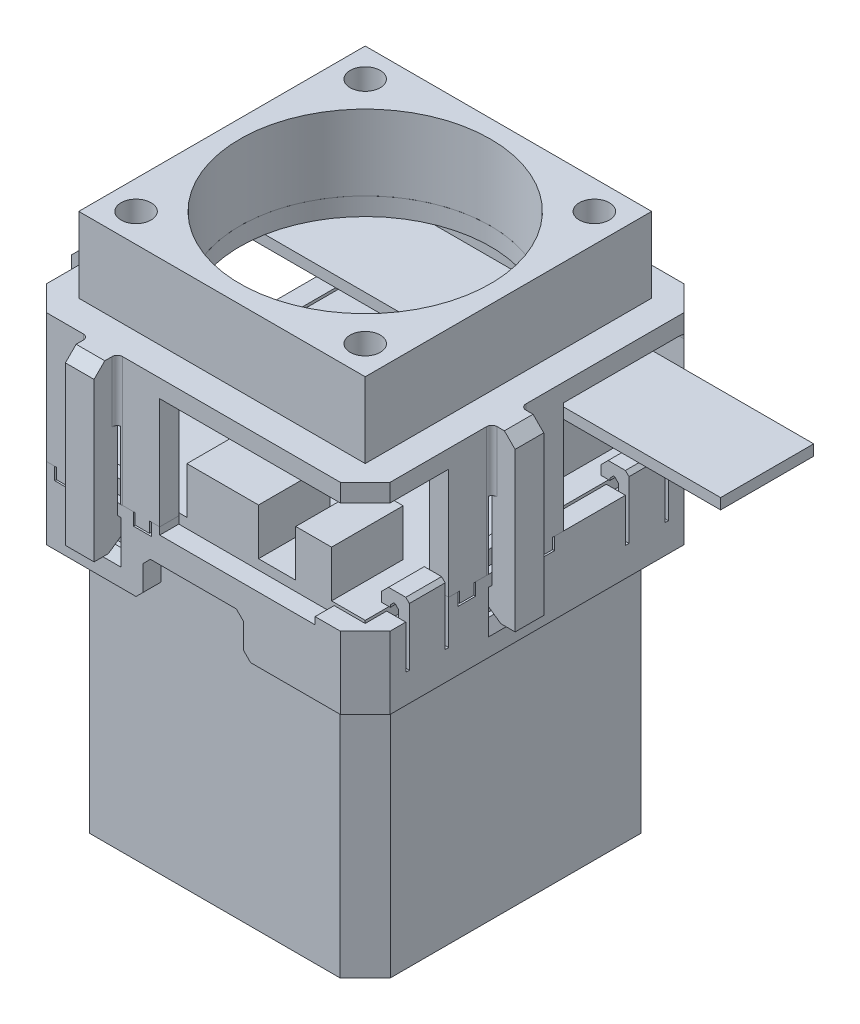
from build123d import *
from OCP.BRepFilletAPI import BRepFilletAPI_MakeChamfer

# Parameters (mm, degrees)
SKETCH1_W              = 41.91
SKETCH1_H              = 41.91
BOSS_EXTRUDE1_DEPTH    = 1.5748
SKETCH3_W              = 42
SKETCH3_H              = 42
BOSS_EXTRUDE2_DEPTH    = 40.386
CHAMFER1_SIZE          = 3.5
SKETCH4_W              = 6.2
SKETCH4_H              = 16.5
BOSS_EXTRUDE3_DEPTH    = 13
SKETCH5_W              = 74.640338871
SKETCH5_H              = 13
BOSS_EXTRUDE4_DEPTH    = 1.5
SKETCH6_W              = 10
SKETCH6_H              = 10
SKETCH6_W_2            = 5
BOSS_EXTRUDE5_DEPTH    = 6.5
BOSS_EXTRUDE6_DEPTH    = 5.5
BOSS_EXTRUDE7_DEPTH    = 3
SKETCH12_W             = 42.672
SKETCH12_H             = 42.672
BOSS_EXTRUDE8_DEPTH    = 1.5748
SKETCH13_W             = 2.336
SKETCH13_H             = 7
SKETCH13_W_2           = 6
SKETCH13_H_2           = 2.164427125
SKETCH13_W_3           = 8
SKETCH13_H_3           = 1.5
CUT_EXTRUDE2_DEPTH     = 3
SKETCH14_W             = 2
SKETCH14_H             = 6
CUT_EXTRUDE3_DEPTH     = 6.0748
SKETCH15_W             = 1.5
SKETCH15_H             = 5
BOSS_EXTRUDE9_DEPTH    = 7.0748
SKETCH16_W             = 3.914
SKETCH16_H             = 5
BOSS_EXTRUDE10_DEPTH   = 1.5
SKETCH9_W              = 14
SKETCH9_H              = 2.5
CUT_EXTRUDE1_DEPTH     = 5.5
SKETCH18_W             = 0.664
SKETCH18_H             = 6
CUT_EXTRUDE4_DEPTH     = 1.5748
SKETCH17_W             = 1.25
SKETCH17_H             = 5
BOSS_EXTRUDE11_DEPTH   = 0.7968
CHAMFER2_SIZE          = 0.5
CHAMFER3_SIZE          = 1
CHAMFER4_SIZE          = 1
CHAMFER5_SIZE          = 1
CHAMFER6_SIZE          = 0.5
SKETCH19_W             = 21.7
SKETCH19_H             = 1
CUT_EXTRUDE5_DEPTH     = 2.664
SKETCH20_W             = 40
SKETCH20_H             = 40
SKETCH20_R             = 17.5
SKETCH20_R_2           = 2.1
BOSS_EXTRUDE12_DEPTH   = 10.5
SKETCH21_W             = 2.664
SKETCH21_H             = 16.041
BOSS_EXTRUDE13_DEPTH   = 18
BOSS_EXTRUDE13_2_DEPTH = 18
BOSS_EXTRUDE13_3_DEPTH = 18
SKETCH22_R             = 17.5
SKETCH22_R_2           = 1.25
BOSS_EXTRUDE14_DEPTH   = 2.5
FILLET1_R              = 1.5
SKETCH23_R             = 3.25
SKETCH23_R_2           = 1.25
BOSS_EXTRUDE15_DEPTH   = 1
SKETCH25_W             = 5
SKETCH25_H             = 1
SKETCH25_W_2           = 1
SKETCH25_H_2           = 5
CUT_EXTRUDE6_DEPTH     = 9.5
SKETCH26_W             = 5
SKETCH26_H             = 1.5
SKETCH26_W_2           = 1.5
SKETCH26_H_2           = 5
CUT_EXTRUDE7_DEPTH     = 4.5
CHAMFER7_SIZE          = 1.5
CHAMFER7_SIZE2         = 0.866025404
BOSS_EXTRUDE16_REACH   = 102.968
SKETCH28_W             = 4
SKETCH28_H             = 3.25
SKETCH28_W_2           = 3.25
SKETCH28_H_2           = 4
SKETCH29_W             = 4
SKETCH29_H             = 5.25
SKETCH29_W_2           = 5.25
SKETCH29_H_2           = 4
BOSS_EXTRUDE17_DEPTH   = 4
FILLET3_START          = 11.0748
FILLET3_DEPTH          = 8.5
FILLET3_START_2        = 1.5748
FILLET3_2_DEPTH        = 9.5
CHAMFER10_SIZE         = 1.5
CHAMFER11_SIZE         = 3.25
CHAMFER11_SIZE2        = 2.275674499
SKETCH31_W             = 2
SKETCH31_H             = 2.164
SKETCH31_W_2           = 2.164
SKETCH31_H_2           = 2
BOSS_EXTRUDE18_DEPTH   = 1.5
SKETCH32_W             = 2.5
SKETCH32_H             = 2.664
SKETCH32_W_2           = 2.664
SKETCH32_H_2           = 2.5
CUT_EXTRUDE9_DEPTH     = 1.75
SKETCH33_W             = 5
SKETCH33_H             = 7.5
CUT_EXTRUDE10_DEPTH    = 1.664
SKETCH34_W             = 5
SKETCH34_H             = 7.5
CUT_EXTRUDE11_DEPTH    = 1.664
SKETCH35_W             = 5
SKETCH35_H             = 7.5
CUT_EXTRUDE12_DEPTH    = 1.664
SKETCH36_W             = 5
SKETCH36_H             = 7.5
CUT_EXTRUDE13_DEPTH    = 1.664


with BuildPart() as part:
    # Sketch1 → Boss-Extrude1 (new body)
    with BuildSketch(Plane(origin=(0, 0, 0), x_dir=(1, 0, 0), z_dir=(0, 1, 0))):
        with Locations((20.955, 20.955)):
            Rectangle(SKETCH1_W, SKETCH1_H)
    extrude(amount=BOSS_EXTRUDE1_DEPTH)

    # Sketch4 → Boss-Extrude3 (add)
    with BuildSketch(Plane(origin=(0, 1.5748, 0), x_dir=(1, 0, 0), z_dir=(0, 1, 0))):
        with Locations((35.31, 33.16)):
            Rectangle(SKETCH4_W, SKETCH4_H)
    extrude(amount=BOSS_EXTRUDE3_DEPTH)

    # Sketch5 → Boss-Extrude4 (add)
    with BuildSketch(Plane(origin=(0, 14.5748, 0), x_dir=(1, 0, 0), z_dir=(0, 1, 0))):
        with Locations((27.561027235, 33.16)):
            Rectangle(SKETCH5_W, SKETCH5_H)
    extrude(amount=-BOSS_EXTRUDE4_DEPTH)

    # Sketch6 → Boss-Extrude5 (add)
    with BuildSketch(Plane(origin=(0, 1.5748, 0), x_dir=(1, 0, 0), z_dir=(0, 1, 0))):
        with Locations((22.01, 5)):
            Rectangle(SKETCH6_W, SKETCH6_H)
        with Locations((34.71, 5)):
            Rectangle(SKETCH6_W_2, SKETCH6_H)
    extrude(amount=BOSS_EXTRUDE5_DEPTH)


with BuildPart() as body_2:
    # Sketch3 → Boss-Extrude2 (new body)
    with BuildSketch(Plane(origin=(0, -3, 0), x_dir=(-1, 0, 0), z_dir=(0, -1, 0))):
        with Locations((-20.955, 20.955)):
            Rectangle(SKETCH3_W, SKETCH3_H)
    extrude(amount=BOSS_EXTRUDE2_DEPTH)

    # Chamfer1
    chamfer1_edges = [body_2.edges().sort_by_distance(p)[0] for p in [
        (41.955, -23.193, -41.955),
        (-0.045, -23.193, -41.955),
        (-0.045, -23.193, 0.045),
        (41.955, -23.193, 0.045),
    ]]
    chamfer(chamfer1_edges, length=CHAMFER1_SIZE)


with BuildPart() as body_3:
    # Sketch7 → Boss-Extrude6 (new body)
    with BuildSketch(Plane(origin=(0, -3, 0), x_dir=(1, 0, 0), z_dir=(0, 1, 0))):
        Polygon((41.490533906, 44.955), (0.419466094, 44.955), (-3.045, 41.490533906), (-3.045, 0.419466094), (0.419466094, -3.045), (41.490533906, -3.045), (44.955, 0.419466094), (44.955, 41.490533906), align=None)
        Polygon((1.455, 42.455), (-0.545, 40.455), (-0.545, 1.455), (1.455, -0.545), (40.455, -0.545), (42.455, 1.455), (42.455, 40.455), (40.455, 42.455), align=None, mode=Mode.SUBTRACT)
    extrude(amount=-BOSS_EXTRUDE6_DEPTH)

    # Sketch11 → Boss-Extrude7 (add)
    with BuildSketch(Plane(origin=(0, -3, 0), x_dir=(1, 0, 0), z_dir=(0, 1, 0))):
        Polygon((44.955, 41.490533906), (41.490533906, 44.955), (0.419466094, 44.955), (-3.045, 41.490533906), (-3.045, 0.419466094), (0.419466094, -3.045), (41.490533906, -3.045), (44.955, 0.419466094), align=None)
        Polygon((1.955, 37.626572875), (1.955, 4.283427125), (4.283427125, 1.955), (37.626572875, 1.955), (39.955, 4.283427125), (39.955, 37.626572875), (37.626572875, 39.955), (4.283427125, 39.955), align=None, mode=Mode.SUBTRACT)
    extrude(amount=BOSS_EXTRUDE7_DEPTH)

    # Sketch12 → Boss-Extrude8 (add)
    with BuildSketch(Plane(origin=(0, 0, 0), x_dir=(1, 0, 0), z_dir=(0, 1, 0))):
        Polygon((44.955, 0.419466094), (44.955, 41.490533906), (41.490533906, 44.955), (0.419466094, 44.955), (-3.045, 41.490533906), (-3.045, 0.419466094), (0.419466094, -3.045), (41.490533906, -3.045), align=None)
        with Locations((20.955, 20.955)):
            Rectangle(SKETCH12_W, SKETCH12_H, mode=Mode.SUBTRACT)
    extrude(amount=BOSS_EXTRUDE8_DEPTH)

    # Sketch13 → Cut-Extrude2 (cut)
    with BuildSketch(Plane(origin=(0, 0, 0), x_dir=(1, 0, 0), z_dir=(0, 1, 0))):
        with Locations((0.787, 33.291)):
            Rectangle(SKETCH13_W, SKETCH13_H)
        with Locations((35.291, 1.537213563)):
            Rectangle(SKETCH13_W_2, SKETCH13_H_2)
        with Locations((11.119, 40.705)):
            Rectangle(SKETCH13_W_3, SKETCH13_H_3)
    extrude(amount=-CUT_EXTRUDE2_DEPTH, mode=Mode.SUBTRACT)

    # Sketch14 → Cut-Extrude3 (cut)
    with BuildSketch(Plane(origin=(0, 1.5748, 0), x_dir=(1, 0, 0), z_dir=(0, 1, 0))):
        with Locations((-2.045, 20.955)):
            Rectangle(SKETCH14_W, SKETCH14_H)
        with Locations((43.955, 36.291)):
            Rectangle(SKETCH14_W, SKETCH14_H)
        with Locations((43.955, 5.619)):
            Rectangle(SKETCH14_W, SKETCH14_H)
    extrude(amount=-CUT_EXTRUDE3_DEPTH, mode=Mode.SUBTRACT)

    # Sketch15 → Boss-Extrude9 (add)
    with BuildSketch(Plane(origin=(0, -4.5, 0), x_dir=(1, 0, 0), z_dir=(0, 1, 0))):
        with Locations((-2.295, 20.955)):
            Rectangle(SKETCH15_W, SKETCH15_H)
        with Locations((44.205, 36.291)):
            Rectangle(SKETCH15_W, SKETCH15_H)
        with Locations((44.205, 5.619)):
            Rectangle(SKETCH15_W, SKETCH15_H)
    extrude(amount=BOSS_EXTRUDE9_DEPTH)

    # Sketch16 → Boss-Extrude10 (add)
    with BuildSketch(Plane(origin=(0, 2.5748, 0), x_dir=(1, 0, 0), z_dir=(0, 1, 0))):
        with Locations((-1.088, 20.955)):
            Rectangle(SKETCH16_W, SKETCH16_H)
        with Locations((42.998, 36.291)):
            Rectangle(SKETCH16_W, SKETCH16_H)
        with Locations((42.998, 5.619)):
            Rectangle(SKETCH16_W, SKETCH16_H)
    extrude(amount=BOSS_EXTRUDE10_DEPTH)

    # Sketch9 → Cut-Extrude1 (cut)
    with BuildSketch(Plane(origin=(0, -8.5, 0), x_dir=(1, 0, 0), z_dir=(0, 1, 0))):
        with Locations((20.955, -1.795)):
            Rectangle(SKETCH9_W, SKETCH9_H)
    extrude(amount=CUT_EXTRUDE1_DEPTH, mode=Mode.SUBTRACT)

    # Sketch18 → Cut-Extrude4 (cut)
    with BuildSketch(Plane(origin=(0, 1.5748, 0), x_dir=(1, 0, 0), z_dir=(0, 1, 0))):
        with Locations((-0.713, 20.955)):
            Rectangle(SKETCH18_W, SKETCH18_H)
        with Locations((42.623, 36.291)):
            Rectangle(SKETCH18_W, SKETCH18_H)
        with Locations((42.623, 5.619)):
            Rectangle(SKETCH18_W, SKETCH18_H)
    extrude(amount=-CUT_EXTRUDE4_DEPTH, mode=Mode.SUBTRACT)

    # Sketch17 → Boss-Extrude11 (add)
    with BuildSketch(Plane.XZ.offset(-2.5748)):
        with Locations((0.244, -20.955)):
            Rectangle(SKETCH17_W, SKETCH17_H)
        with Locations((41.666, -5.619)):
            Rectangle(SKETCH17_W, SKETCH17_H)
        with Locations((41.666, -36.291)):
            Rectangle(SKETCH17_W, SKETCH17_H)
    extrude(amount=BOSS_EXTRUDE11_DEPTH)

    # Chamfer2
    chamfer2_edges = [body_3.edges().sort_by_distance(p)[0] for p in [
        (-0.381, 2.5748, -20.955),
        (-1.545, 2.5748, -20.955),
        (42.291, 2.5748, -5.619),
        (43.455, 2.5748, -5.619),
        (43.455, 2.5748, -36.291),
        (42.291, 2.5748, -36.291),
    ]]
    chamfer(chamfer2_edges, length=CHAMFER2_SIZE)

    # Chamfer3
    chamfer3_edges = [body_3.edges().sort_by_distance(p)[0] for p in [
        (0.869, 4.0748, -20.955),
        (41.041, 4.0748, -36.291),
        (41.041, 4.0748, -5.619),
    ]]
    chamfer(chamfer3_edges, length=CHAMFER3_SIZE)

    # Chamfer4
    chamfer4_edges = [body_3.edges().sort_by_distance(p)[0] for p in [
        (20.955, -8.5, -42.455),
        (41.455, -8.5, -41.455),
        (42.455, -8.5, -20.955),
        (41.455, -8.5, -0.455),
        (7.705, -8.5, 0.545),
        (0.455, -8.5, -0.455),
        (-0.545, -8.5, -20.955),
        (34.205, -8.5, 0.545),
        (0.455, -8.5, -41.455),
    ]]
    chamfer(chamfer4_edges, length=CHAMFER4_SIZE)

    # Chamfer5
    chamfer5_edges = [body_3.edges().sort_by_distance(p)[0] for p in [
        (13.955, -8.5, 2.295),
        (27.955, -8.5, 2.295),
        (27.955, -3, 1.795),
        (13.955, -3, 1.795),
    ]]
    chamfer(chamfer5_edges, length=CHAMFER5_SIZE)

    # Chamfer6
    chamfer6_edges = [body_3.edges().sort_by_distance(p)[0] for p in [
        (-3.045, 4.0748, -20.955),
        (44.955, 4.0748, -36.291),
        (44.955, 4.0748, -5.619),
    ]]
    chamfer(chamfer6_edges, length=CHAMFER6_SIZE)

    # Sketch19 → Cut-Extrude5 (cut)
    with BuildSketch(Plane.XY.offset(3.045)):
        with Locations((27.11, 1.0748)):
            Rectangle(SKETCH19_W, SKETCH19_H)
    extrude(amount=-CUT_EXTRUDE5_DEPTH, mode=Mode.SUBTRACT)

    # Sketch26 → Cut-Extrude7 (cut)
    with BuildSketch(Plane.XZ):
        with Locations((8.339733047, 2.295)):
            Rectangle(SKETCH26_W, SKETCH26_H)
        with Locations((-2.295, -9.187233047)):
            Rectangle(SKETCH26_W_2, SKETCH26_H_2)
        with Locations((20.955, -44.205)):
            Rectangle(SKETCH26_W, SKETCH26_H)
        with Locations((44.205, -16.6395)):
            Rectangle(SKETCH26_W_2, SKETCH26_H_2)
    extrude(amount=CUT_EXTRUDE7_DEPTH, mode=Mode.SUBTRACT)

    # Chamfer7: one chamfer whose edges measure the first distance from different faces: ONE call of the kernel's chamfer builder (chamfer() names one face for all edges)
    chamfer7_edges_1 = [body_3.edges().sort_by_distance(p)[0] for p in [
        (8.339733047, -4.5, 3.045),
    ]]
    chamfer7_side_1 = [body_3.faces().sort_by_distance(p)[0] for p in [
        (28.75402627, -7.70097373, 3.045),
    ]]
    chamfer7_edges_2 = [body_3.edges().sort_by_distance(p)[0] for p in [
        (44.955, -4.5, -16.6395),
    ]]
    chamfer7_side_2 = [body_3.faces().sort_by_distance(p)[0] for p in [
        (44.955, -3.289311231, -21.198274054),
    ]]
    chamfer7_edges_3 = [body_3.edges().sort_by_distance(p)[0] for p in [
        (20.955, -4.5, -44.955),
    ]]
    chamfer7_side_3 = [body_3.faces().sort_by_distance(p)[0] for p in [
        (20.955, -8.077112993, -44.955),
    ]]
    chamfer7_edges_4 = [body_3.edges().sort_by_distance(p)[0] for p in [
        (-3.045, -4.5, -9.187233047),
    ]]
    chamfer7_side_4 = [body_3.faces().sort_by_distance(p)[0] for p in [
        (-3.045, -3.409612965, -21.624963059),
    ]]
    chamfer7 = BRepFilletAPI_MakeChamfer(body_3.part.solid().wrapped)
    for e in chamfer7_edges_1:
        chamfer7.Add(CHAMFER7_SIZE, CHAMFER7_SIZE2, e.wrapped, chamfer7_side_1[0].wrapped)  # the first distance lies on this face
    for e in chamfer7_edges_2:
        chamfer7.Add(CHAMFER7_SIZE, CHAMFER7_SIZE2, e.wrapped, chamfer7_side_2[0].wrapped)  # the first distance lies on this face
    for e in chamfer7_edges_3:
        chamfer7.Add(CHAMFER7_SIZE, CHAMFER7_SIZE2, e.wrapped, chamfer7_side_3[0].wrapped)  # the first distance lies on this face
    for e in chamfer7_edges_4:
        chamfer7.Add(CHAMFER7_SIZE, CHAMFER7_SIZE2, e.wrapped, chamfer7_side_4[0].wrapped)  # the first distance lies on this face
    add(Compound.cast(chamfer7.Shape()), mode=Mode.REPLACE)


with BuildPart() as body_4:
    # Sketch20 → Boss-Extrude12 (new body)
    with BuildSketch(Plane(origin=(0, 19.5748, 0), x_dir=(1, 0, 0), z_dir=(0, 1, 0))):
        with Locations((20.955, 20.955)):
            Rectangle(SKETCH20_W, SKETCH20_H)
        with Locations(Location((20.955, 20.955, 0), (0, 0, 90))):
            Circle(SKETCH20_R, mode=Mode.SUBTRACT)
        with Locations(Location((4.955, 36.955, 0), (0, 0, 90))):
            Circle(SKETCH20_R_2, mode=Mode.SUBTRACT)
        with Locations(Location((36.955, 36.955, 0), (0, 0, 90))):
            Circle(SKETCH20_R_2, mode=Mode.SUBTRACT)
        with Locations(Location((4.955, 4.955, 0), (0, 0, 90))):
            Circle(SKETCH20_R_2, mode=Mode.SUBTRACT)
        with Locations(Location((36.955, 4.955, 0), (0, 0, 90))):
            Circle(SKETCH20_R_2, mode=Mode.SUBTRACT)
    extrude(amount=BOSS_EXTRUDE12_DEPTH)


with BuildPart() as body_5:
    # Sketch21 → Boss-Extrude13 (new body)
    with BuildSketch(Plane.XZ.offset(-19.5748)):
        with Locations((43.623, -16.6395)):
            Rectangle(SKETCH21_W, SKETCH21_H)
    extrude(amount=BOSS_EXTRUDE13_DEPTH)


with BuildPart() as body_6:
    # Sketch21 → Boss-Extrude13 2 (new body)
    with BuildSketch(Plane.XZ.offset(-19.5748)):
        Polygon((16.26, 0.381), (16.26, 3.045), (0.419466094, 3.045), (-3.045, -0.419466094), (-3.045, -17.955), (-0.381, -17.955), (-0.381, 0.381), align=None)
    extrude(amount=BOSS_EXTRUDE13_2_DEPTH)


    add(body_5.part)  # Boss-Extrude14 merges body 5


with BuildPart() as body_7:
    # Sketch21 → Boss-Extrude13 3 (new body)
    with BuildSketch(Plane.XZ.offset(-19.5748)):
        Polygon((41.490533906, -44.955), (44.154533906, -42.291), (-2.244533906, -42.291), (0.419466094, -44.955), align=None)
    extrude(amount=BOSS_EXTRUDE13_3_DEPTH)


with BuildPart() as body_6_1:
    add(body_6.part)

    add(body_7.part)  # Boss-Extrude14 merges body 7
    # Sketch22 → Boss-Extrude14 (add)
    with BuildSketch(Plane(origin=(0, 19.5748, 0), x_dir=(1, 0, 0), z_dir=(0, 1, 0))):
        Polygon((0.419466094, 44.955), (41.490533906, 44.955), (44.955, 41.490533906), (44.955, 0.419466094), (41.490533906, -3.045), (0.419466094, -3.045), (-3.045, 0.419466094), (-3.045, 41.490533906), align=None)
        with Locations(Location((20.955, 20.955, 0), (0, 0, 270))):
            Circle(SKETCH22_R, mode=Mode.SUBTRACT)
        with Locations(Location((4.955, 36.955, 0), (0, 0, 270))):
            Circle(SKETCH22_R_2, mode=Mode.SUBTRACT)
        with Locations(Location((36.955, 36.955, 0), (0, 0, 270))):
            Circle(SKETCH22_R_2, mode=Mode.SUBTRACT)
        with Locations(Location((36.955, 4.955, 0), (0, 0, 270))):
            Circle(SKETCH22_R_2, mode=Mode.SUBTRACT)
        with Locations(Location((4.955, 4.955, 0), (0, 0, 270))):
            Circle(SKETCH22_R_2, mode=Mode.SUBTRACT)
    extrude(amount=-BOSS_EXTRUDE14_DEPTH)

    # Fillet1
    fillet1_edges = [body_6_1.edges().sort_by_distance(p)[0] for p in [
        (42.291, 17.0748, -16.6395),
        (7.9395, 17.0748, 0.381),
        (-0.381, 17.0748, -8.787),
        (20.955, 17.0748, -42.291),
    ]]
    fillet(fillet1_edges, radius=FILLET1_R)

    # Sketch23 → Boss-Extrude15 (add)
    # profile 1 of 4: a face of its own
    with BuildSketch(Plane.XZ.offset(-17.0748)):
        with Locations(Location((4.955, -36.955, 0), (0, 0, 270))):
            Circle(SKETCH23_R)
        with Locations(Location((4.955, -36.955, 0), (0, 0, 90))):
            Circle(SKETCH23_R_2, mode=Mode.SUBTRACT)
    # profile 2 of 4: a face of its own
    with BuildSketch(Plane.XZ.offset(-17.0748)):
        with Locations(Location((36.955, -36.955, 0), (0, 0, 270))):
            Circle(SKETCH23_R)
        with Locations(Location((36.955, -36.955, 0), (0, 0, 90))):
            Circle(SKETCH23_R_2, mode=Mode.SUBTRACT)
    # profile 3 of 4: a face of its own
    with BuildSketch(Plane.XZ.offset(-17.0748)):
        with Locations(Location((4.955, -4.955, 0), (0, 0, 270))):
            Circle(SKETCH23_R)
        with Locations(Location((4.955, -4.955, 0), (0, 0, 90))):
            Circle(SKETCH23_R_2, mode=Mode.SUBTRACT)
    # profile 4 of 4: a face of its own
    with BuildSketch(Plane.XZ.offset(-17.0748)):
        with Locations(Location((36.955, -4.955, 0), (0, 0, 270))):
            Circle(SKETCH23_R)
        with Locations(Location((36.955, -4.955, 0), (0, 0, 90))):
            Circle(SKETCH23_R_2, mode=Mode.SUBTRACT)
    extrude(amount=BOSS_EXTRUDE15_DEPTH)

    # Sketch25 → Cut-Extrude6 (cut)
    with BuildSketch(Plane.XZ.offset(-1.5748)):
        with Locations((8.339733047, 2.545)):
            Rectangle(SKETCH25_W, SKETCH25_H)
        with Locations((-2.545, -9.187233047)):
            Rectangle(SKETCH25_W_2, SKETCH25_H_2)
        with Locations((20.955, -44.455)):
            Rectangle(SKETCH25_W, SKETCH25_H)
        with Locations((44.455, -16.6395)):
            Rectangle(SKETCH25_W_2, SKETCH25_H_2)
    extrude(amount=-CUT_EXTRUDE6_DEPTH, mode=Mode.SUBTRACT)


    # Boss-Extrude16: up to this face of the body (flat: up to its plane)
    boss_extrude16_end = Plane(body_3.part.faces().sort_by_distance((20.955, 0, -44.205))[0])
    # Sketch28 → Boss-Extrude16 (add, up to the picked face)
    with BuildSketch(Plane(origin=(0, 19.5748, 0), x_dir=(1, 0, 0), z_dir=(0, 1, 0)), mode=Mode.PRIVATE) as boss_extrude16_sk1:
        with Locations((8.339733047, -4.67)):
            Rectangle(SKETCH28_W, SKETCH28_H)
    boss_extrude16_tool1 = split(extrude(boss_extrude16_sk1.sketch, amount=-BOSS_EXTRUDE16_REACH, mode=Mode.PRIVATE), bisect_by=boss_extrude16_end, keep=Keep.BOTH, mode=Mode.PRIVATE)
    # Sketch28 → Boss-Extrude16 (add, up to the picked face)
    with BuildSketch(Plane(origin=(0, 19.5748, 0), x_dir=(1, 0, 0), z_dir=(0, 1, 0)), mode=Mode.PRIVATE) as boss_extrude16_sk2:
        with Locations((-4.67, 9.187233047)):
            Rectangle(SKETCH28_W_2, SKETCH28_H_2)
    boss_extrude16_tool2 = split(extrude(boss_extrude16_sk2.sketch, amount=-BOSS_EXTRUDE16_REACH, mode=Mode.PRIVATE), bisect_by=boss_extrude16_end, keep=Keep.BOTH, mode=Mode.PRIVATE)
    # Sketch28 → Boss-Extrude16 (add, up to the picked face)
    with BuildSketch(Plane(origin=(0, 19.5748, 0), x_dir=(1, 0, 0), z_dir=(0, 1, 0)), mode=Mode.PRIVATE) as boss_extrude16_sk3:
        with Locations((20.955, 46.58)):
            Rectangle(SKETCH28_W, SKETCH28_H)
    boss_extrude16_tool3 = split(extrude(boss_extrude16_sk3.sketch, amount=-BOSS_EXTRUDE16_REACH, mode=Mode.PRIVATE), bisect_by=boss_extrude16_end, keep=Keep.BOTH, mode=Mode.PRIVATE)
    # Sketch28 → Boss-Extrude16 (add, up to the picked face)
    with BuildSketch(Plane(origin=(0, 19.5748, 0), x_dir=(1, 0, 0), z_dir=(0, 1, 0)), mode=Mode.PRIVATE) as boss_extrude16_sk4:
        with Locations((46.58, 16.6395)):
            Rectangle(SKETCH28_W_2, SKETCH28_H_2)
    boss_extrude16_tool4 = split(extrude(boss_extrude16_sk4.sketch, amount=-BOSS_EXTRUDE16_REACH, mode=Mode.PRIVATE), bisect_by=boss_extrude16_end, keep=Keep.BOTH, mode=Mode.PRIVATE)
    add(boss_extrude16_tool1.solids().sort_by(Axis((8.339733, 19.5748, 4.67), (0, -1, 0)))[0])
    add(boss_extrude16_tool2.solids().sort_by(Axis((-4.67, 19.5748, -9.187233), (0, -1, 0)))[0])
    add(boss_extrude16_tool3.solids().sort_by(Axis((20.955, 19.5748, -46.58), (0, -1, 0)))[0])
    add(boss_extrude16_tool4.solids().sort_by(Axis((46.58, 19.5748, -16.6395), (0, -1, 0)))[0])

    # Sketch29 → Boss-Extrude17 (add)
    with BuildSketch(Plane.XZ):
        with Locations((8.339733047, 3.67)):
            Rectangle(SKETCH29_W, SKETCH29_H)
        with Locations((-3.67, -9.187233047)):
            Rectangle(SKETCH29_W_2, SKETCH29_H_2)
        with Locations((20.955, -45.58)):
            Rectangle(SKETCH29_W, SKETCH29_H)
        with Locations((45.58, -16.6395)):
            Rectangle(SKETCH29_W_2, SKETCH29_H_2)
    extrude(amount=BOSS_EXTRUDE17_DEPTH)

    # Fillet3: read off the stored shape, not the designer's step
    # Fillet3 outline → Fillet3 (add)
    with BuildSketch(Plane(origin=(0, 0, 0), x_dir=(1, 0, 0), z_dir=(0, 1, 0)).offset(FILLET3_START)):
        with BuildLine():
            Line((44.955, 18.6395), (45.705, 18.6395))
            ThreePointArc((45.705, 18.6395), (45.174669914, 18.859169914), (44.955, 19.3895))
            Line((44.955, 19.3895), (44.955, 18.6395))
        make_face()
        with BuildLine():
            ThreePointArc((44.955, 13.8895), (45.174669914, 14.419830086), (45.705, 14.6395))
            Line((45.705, 14.6395), (44.955, 14.6395))
            Line((44.955, 14.6395), (44.955, 13.8895))
        make_face()
        with BuildLine():
            Line((11.089733047, -3.045), (10.339733047, -3.045))
            Line((10.339733047, -3.045), (10.339733047, -3.795))
            ThreePointArc((10.339733047, -3.795), (10.559402961, -3.264669914), (11.089733047, -3.045))
        make_face()
        with BuildLine():
            Line((6.339733047, -3.795), (6.339733047, -3.045))
            Line((6.339733047, -3.045), (5.589733047, -3.045))
            ThreePointArc((5.589733047, -3.045), (6.120063133, -3.264669914), (6.339733047, -3.795))
        make_face()
        with BuildLine():
            Line((-3.045, 6.437233047), (-3.045, 7.187233047))
            Line((-3.045, 7.187233047), (-3.795, 7.187233047))
            ThreePointArc((-3.795, 7.187233047), (-3.264669914, 6.967563133), (-3.045, 6.437233047))
        make_face()
        with BuildLine():
            Line((-3.795, 11.187233047), (-3.045, 11.187233047))
            Line((-3.045, 11.187233047), (-3.045, 11.937233047))
            ThreePointArc((-3.045, 11.937233047), (-3.264669914, 11.406902961), (-3.795, 11.187233047))
        make_face()
        with BuildLine():
            Line((18.955, 44.955), (18.955, 45.705))
            ThreePointArc((18.955, 45.705), (18.735330086, 45.174669914), (18.205, 44.955))
            Line((18.205, 44.955), (18.955, 44.955))
        make_face()
        with BuildLine():
            ThreePointArc((23.705, 44.955), (23.174669914, 45.174669914), (22.955, 45.705))
            Line((22.955, 45.705), (22.955, 44.955))
            Line((22.955, 44.955), (23.705, 44.955))
        make_face()
    extrude(amount=FILLET3_DEPTH)

    # Fillet3 2 outline → Fillet3 2 (add)
    with BuildSketch(Plane(origin=(0, 0, 0), x_dir=(1, 0, 0), z_dir=(0, 1, 0)).offset(FILLET3_START_2)):
        with BuildLine():
            Line((44.955, 19.1395), (44.997893219, 19.1395))
            ThreePointArc((44.997893219, 19.1395), (44.96580108, 19.262673516), (44.955, 19.3895))
            Line((44.955, 19.3895), (44.955, 19.1395))
        make_face()
        with BuildLine():
            Line((44.955, 14.1395), (44.955, 13.8895))
            ThreePointArc((44.955, 13.8895), (44.96580108, 14.016326484), (44.997893219, 14.1395))
            Line((44.997893219, 14.1395), (44.955, 14.1395))
        make_face()
        with BuildLine():
            ThreePointArc((10.839733047, -3.087893219), (10.962906563, -3.05580108), (11.089733047, -3.045))
            Line((11.089733047, -3.045), (10.839733047, -3.045))
            Line((10.839733047, -3.045), (10.839733047, -3.087893219))
        make_face()
        with BuildLine():
            ThreePointArc((5.589733047, -3.045), (5.716559531, -3.05580108), (5.839733047, -3.087893219))
            Line((5.839733047, -3.087893219), (5.839733047, -3.045))
            Line((5.839733047, -3.045), (5.589733047, -3.045))
        make_face()
        with BuildLine():
            ThreePointArc((-3.087893219, 6.687233047), (-3.05580108, 6.564059531), (-3.045, 6.437233047))
            Line((-3.045, 6.437233047), (-3.045, 6.687233047))
            Line((-3.045, 6.687233047), (-3.087893219, 6.687233047))
        make_face()
        with BuildLine():
            ThreePointArc((-3.045, 11.937233047), (-3.05580108, 11.810406563), (-3.087893219, 11.687233047))
            Line((-3.087893219, 11.687233047), (-3.045, 11.687233047))
            Line((-3.045, 11.687233047), (-3.045, 11.937233047))
        make_face()
        with BuildLine():
            Line((18.455, 44.955), (18.455, 44.997893219))
            ThreePointArc((18.455, 44.997893219), (18.331826484, 44.96580108), (18.205, 44.955))
            Line((18.205, 44.955), (18.455, 44.955))
        make_face()
        with BuildLine():
            Line((23.455, 44.955), (23.705, 44.955))
            ThreePointArc((23.705, 44.955), (23.578173516, 44.96580108), (23.455, 44.997893219))
            Line((23.455, 44.997893219), (23.455, 44.955))
        make_face()
    extrude(amount=FILLET3_2_DEPTH)

    # Chamfer10
    chamfer10_edges = [body_6_1.edges().sort_by_distance(p)[0] for p in [
        (8.339733047, 19.5748, 6.295),
        (-6.295, 19.5748, -9.187233047),
        (20.955, 19.5748, -48.205),
        (48.205, 19.5748, -16.6395),
    ]]
    chamfer(chamfer10_edges, length=CHAMFER10_SIZE)

    # Chamfer11: one chamfer whose edges measure the first distance from different faces: ONE call of the kernel's chamfer builder (chamfer() names one face for all edges)
    chamfer11_edges_1 = [body_6_1.edges().sort_by_distance(p)[0] for p in [
        (8.339733047, -4, 1.045),
    ]]
    chamfer11_side_1 = [body_6_1.faces().sort_by_distance(p)[0] for p in [
        (8.339733047, -4, 3.67),
    ]]
    chamfer11_edges_2 = [body_6_1.edges().sort_by_distance(p)[0] for p in [
        (-1.045, -4, -9.187233047),
    ]]
    chamfer11_side_2 = [body_6_1.faces().sort_by_distance(p)[0] for p in [
        (-3.67, -4, -9.187233047),
    ]]
    chamfer11_edges_3 = [body_6_1.edges().sort_by_distance(p)[0] for p in [
        (20.955, -4, -42.955),
    ]]
    chamfer11_side_3 = [body_6_1.faces().sort_by_distance(p)[0] for p in [
        (20.955, -4, -45.58),
    ]]
    chamfer11_edges_4 = [body_6_1.edges().sort_by_distance(p)[0] for p in [
        (42.955, -4, -16.6395),
    ]]
    chamfer11_side_4 = [body_6_1.faces().sort_by_distance(p)[0] for p in [
        (45.58, -4, -16.6395),
    ]]
    chamfer11 = BRepFilletAPI_MakeChamfer(body_6_1.part.solid().wrapped)
    for e in chamfer11_edges_1:
        chamfer11.Add(CHAMFER11_SIZE, CHAMFER11_SIZE2, e.wrapped, chamfer11_side_1[0].wrapped)  # the first distance lies on this face
    for e in chamfer11_edges_2:
        chamfer11.Add(CHAMFER11_SIZE, CHAMFER11_SIZE2, e.wrapped, chamfer11_side_2[0].wrapped)  # the first distance lies on this face
    for e in chamfer11_edges_3:
        chamfer11.Add(CHAMFER11_SIZE, CHAMFER11_SIZE2, e.wrapped, chamfer11_side_3[0].wrapped)  # the first distance lies on this face
    for e in chamfer11_edges_4:
        chamfer11.Add(CHAMFER11_SIZE, CHAMFER11_SIZE2, e.wrapped, chamfer11_side_4[0].wrapped)  # the first distance lies on this face
    add(Compound.cast(chamfer11.Shape()), mode=Mode.REPLACE)

    # Sketch31 → Boss-Extrude18 (add)
    with BuildSketch(Plane.XZ.offset(-1.5748)):
        with Locations((2.839733047, 1.963)):
            Rectangle(SKETCH31_W, SKETCH31_H)
        with Locations((-1.963, -3.687233047)):
            Rectangle(SKETCH31_W_2, SKETCH31_H_2)
        with Locations((9.955, -43.873)):
            Rectangle(SKETCH31_W, SKETCH31_H)
        with Locations((43.873, -11.1395)):
            Rectangle(SKETCH31_W_2, SKETCH31_H_2)
        with Locations((31.955, -43.873)):
            Rectangle(SKETCH31_W, SKETCH31_H)
        with Locations((-1.963, -14.687233047)):
            Rectangle(SKETCH31_W_2, SKETCH31_H_2)
        with Locations((13.839733047, 1.963)):
            Rectangle(SKETCH31_W, SKETCH31_H)
        with Locations((43.873, -22.1395)):
            Rectangle(SKETCH31_W_2, SKETCH31_H_2)
    extrude(amount=BOSS_EXTRUDE18_DEPTH)

    # Sketch33 → Cut-Extrude10 (cut)
    with BuildSketch(Plane.XY.offset(-42.291)):
        with Locations((20.955, 7.3248)):
            Rectangle(SKETCH33_W, SKETCH33_H)
    extrude(amount=-CUT_EXTRUDE10_DEPTH, mode=Mode.SUBTRACT)

    # Sketch34 → Cut-Extrude11 (cut)
    with BuildSketch(Plane.ZY.offset(-42.291)):
        with Locations((-16.6395, 7.3248)):
            Rectangle(SKETCH34_W, SKETCH34_H)
    extrude(amount=-CUT_EXTRUDE11_DEPTH, mode=Mode.SUBTRACT)

    # Sketch35 → Cut-Extrude12 (cut)
    with BuildSketch(Plane(origin=(0, 0, 0.381), x_dir=(-1, 0, 0), z_dir=(0, 0, -1))):
        with Locations((-8.339733047, 7.3248)):
            Rectangle(SKETCH35_W, SKETCH35_H)
    extrude(amount=-CUT_EXTRUDE12_DEPTH, mode=Mode.SUBTRACT)

    # Sketch36 → Cut-Extrude13 (cut)
    with BuildSketch(Plane(origin=(-0.381, 0, 0), x_dir=(0, 0, -1), z_dir=(1, 0, 0))):
        with Locations((9.187233047, 7.3248)):
            Rectangle(SKETCH36_W, SKETCH36_H)
    extrude(amount=-CUT_EXTRUDE13_DEPTH, mode=Mode.SUBTRACT)


with BuildPart() as body_3_1:
    add(body_3.part)

    # Sketch32 → Cut-Extrude9 (cut)
    with BuildSketch(Plane.XZ.offset(-1.5748)):
        with Locations((2.839733047, 1.713)):
            Rectangle(SKETCH32_W, SKETCH32_H)
        with Locations((13.839733047, 1.713)):
            Rectangle(SKETCH32_W, SKETCH32_H)
        with Locations((-1.713, -3.687233047)):
            Rectangle(SKETCH32_W_2, SKETCH32_H_2)
        with Locations((-1.713, -14.687233047)):
            Rectangle(SKETCH32_W_2, SKETCH32_H_2)
        with Locations((9.955, -43.623)):
            Rectangle(SKETCH32_W, SKETCH32_H)
        with Locations((31.955, -43.623)):
            Rectangle(SKETCH32_W, SKETCH32_H)
        with Locations((43.623, -11.1395)):
            Rectangle(SKETCH32_W_2, SKETCH32_H_2)
        with Locations((43.623, -22.1395)):
            Rectangle(SKETCH32_W_2, SKETCH32_H_2)
    extrude(amount=CUT_EXTRUDE9_DEPTH, mode=Mode.SUBTRACT)


solid = Compound([part.part, body_2.part, body_4.part, body_6_1.part, body_3_1.part])
